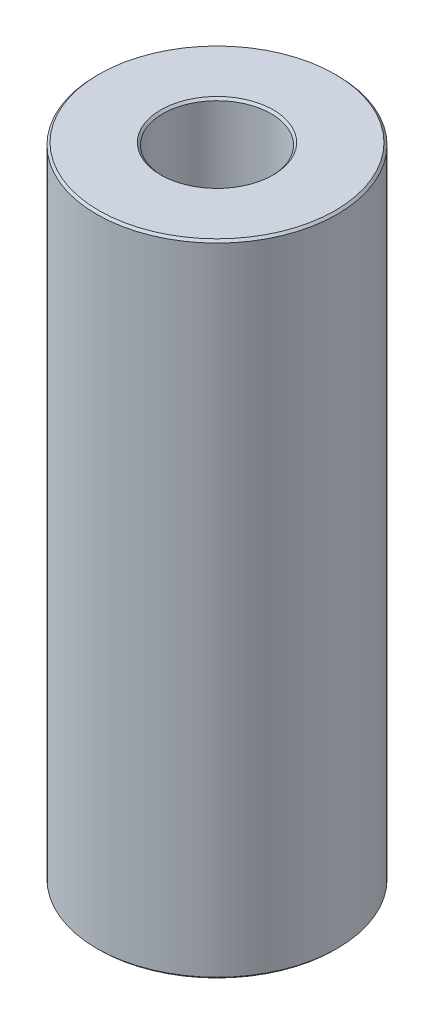
from build123d import *

# Parameters (mm, degrees)
SKETCH1_R           = 47.5
BOSS_EXTRUDE1_DEPTH = 252.839723876
SKETCH2_R           = 21.399500073
CUT_EXTRUDE1_DEPTH  = 262.611211476
CHAMFER1_SIZE       = 0.856978789


with BuildPart() as part:
    # Sketch1 → Boss-Extrude1 (new body)
    with BuildSketch(Plane(origin=(0, 0, 0), x_dir=(1, 0, 0), z_dir=(0, 1, 0))):
        Circle(SKETCH1_R)
    extrude(amount=BOSS_EXTRUDE1_DEPTH)

    # Sketch2 → Cut-Extrude1 (cut, through all)
    with BuildSketch(Plane(origin=(0, 0, 0), x_dir=(1, 0, 0), z_dir=(0, 1, 0))):
        Circle(SKETCH2_R)
    extrude(amount=CUT_EXTRUDE1_DEPTH, mode=Mode.SUBTRACT)

    # Chamfer1
    chamfer1_edges = [part.edges().sort_by_distance(p)[0] for p in [
        (-21.399500073, 252.839723876, 0),
        (-21.399500073, 0, 0),
        (-47.5, 0, 0),
        (-47.5, 252.839723876, 0),
    ]]
    chamfer(chamfer1_edges, length=CHAMFER1_SIZE)


solid = part.part
